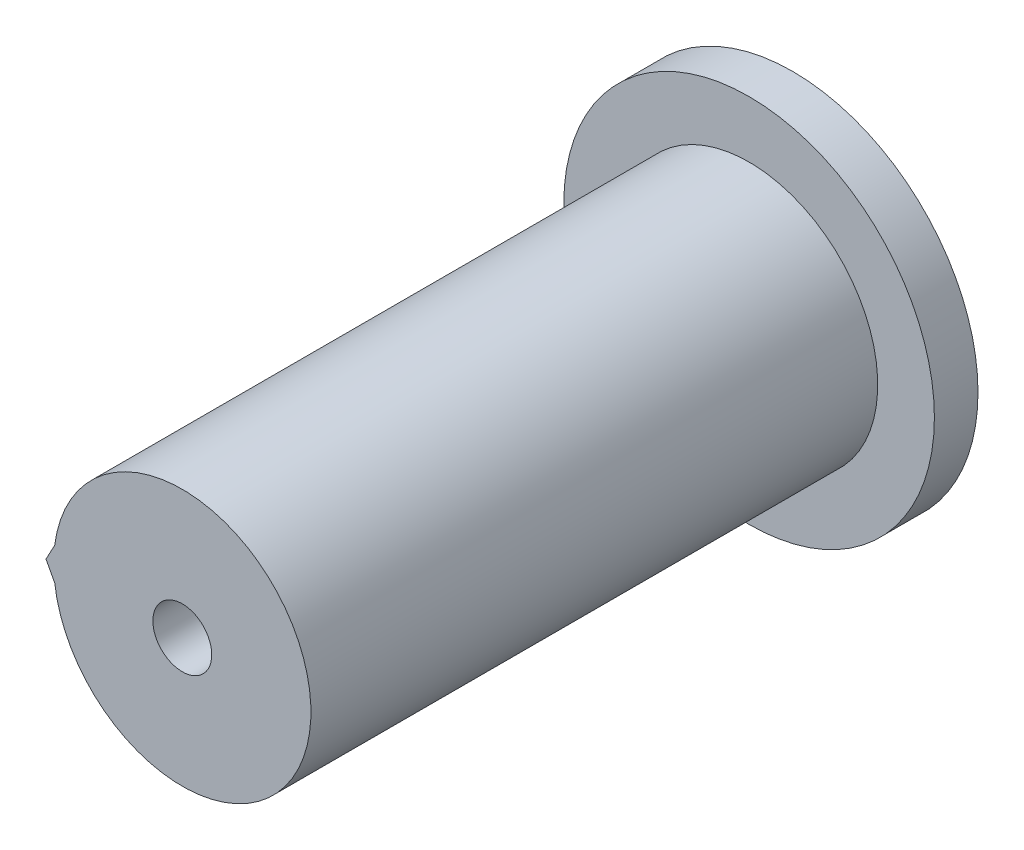
from build123d import *

# Parameters (mm, degrees)
BOSS_EXTRUDE1_DEPTH      = 13
BOSS_EXTRUDE1_DEPTH_BACK = 13
SKETCH2_R                = 1.35
CUT_EXTRUDE1_DEPTH       = 6
SKETCH3_R                = 8.5
BOSS_EXTRUDE2_DEPTH      = 2
CUT_EXTRUDE2_DEPTH       = 12.5


with BuildPart() as part:
    # Sketch1 → Boss-Extrude1 (new, two sides: drawn at the far end of the back side and taken through both)
    with BuildSketch(Plane.XY.offset(-BOSS_EXTRUDE1_DEPTH_BACK)):
        with BuildLine():
            Line((-5.852136362, 0.75), (-6.252136362, 0))
            Line((-6.252136362, 0), (-5.852136362, -0.75))
            ThreePointArc((-5.852136362, -0.75), (5.9, 0), (-5.852136362, 0.75))
        make_face()
    extrude(amount=BOSS_EXTRUDE1_DEPTH + BOSS_EXTRUDE1_DEPTH_BACK)

    # Sketch2 → Cut-Extrude1 (cut)
    with BuildSketch(Plane.XY.offset(13)):
        Circle(SKETCH2_R)
    extrude(amount=-CUT_EXTRUDE1_DEPTH, mode=Mode.SUBTRACT)

    # Sketch3 → Boss-Extrude2 (add)
    with BuildSketch(Plane(origin=(0, 0, -13), x_dir=(-1, 0, 0), z_dir=(0, 0, -1))):
        Circle(SKETCH3_R)
    extrude(amount=BOSS_EXTRUDE2_DEPTH)

    # Sketch4 → Cut-Extrude2 (cut)
    with BuildSketch(Plane(origin=(0, 0, -15), x_dir=(-1, 0, 0), z_dir=(0, 0, -1))):
        with BuildLine():
            Line((2.5, 1.833030278), (2.5, -1.833030278))
            ThreePointArc((2.5, -1.833030278), (-3.1, 0), (2.5, 1.833030278))
        make_face()
    extrude(amount=-CUT_EXTRUDE2_DEPTH, mode=Mode.SUBTRACT)


solid = part.part
